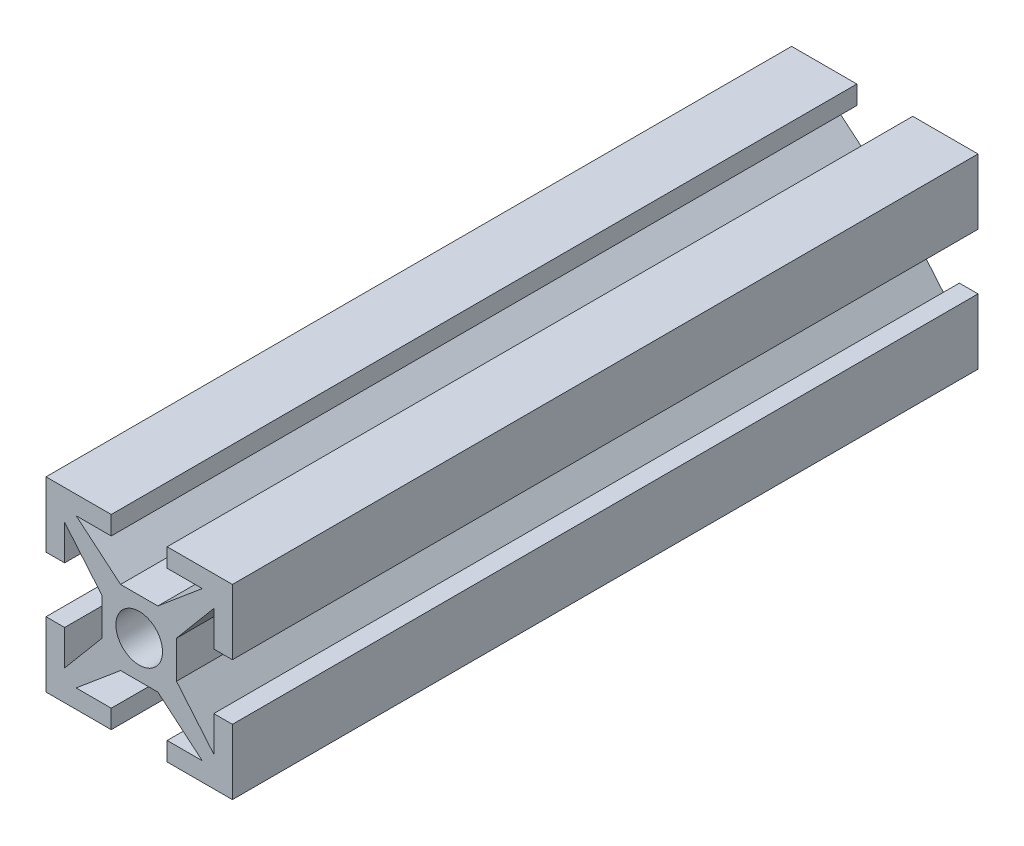
from build123d import *

# Parameters (mm, degrees)
ESQUISSE2_R          = 1.25
MAIN_EXTRUSION_DEPTH = 40


with BuildPart() as part:
    # Esquisse2 → Main Extrusion (new body)
    with BuildSketch(Plane.XY):
        Polygon((-1, -2), (1, -2), (3.383507185, -4), (1.5, -4), (1.5, -5), (5, -5), (5, -1.5), (4, -1.5), (4, -3.383507185), (2, -1), (2, 1), (4, 3.383507185), (4, 1.5), (5, 1.5), (5, 5), (1.5, 5), (1.5, 4), (3.383507185, 4), (1, 2), (-1, 2), (-3.383507185, 4), (-1.5, 4), (-1.5, 5), (-5, 5), (-5, 1.5), (-4, 1.5), (-4, 3.383507185), (-2, 1), (-2, -1), (-4, -3.383507185), (-4, -1.5), (-5, -1.5), (-5, -5), (-1.5, -5), (-1.5, -4), (-3.383507185, -4), align=None)
        Circle(ESQUISSE2_R, mode=Mode.SUBTRACT)
    extrude(amount=MAIN_EXTRUSION_DEPTH)


solid = part.part
